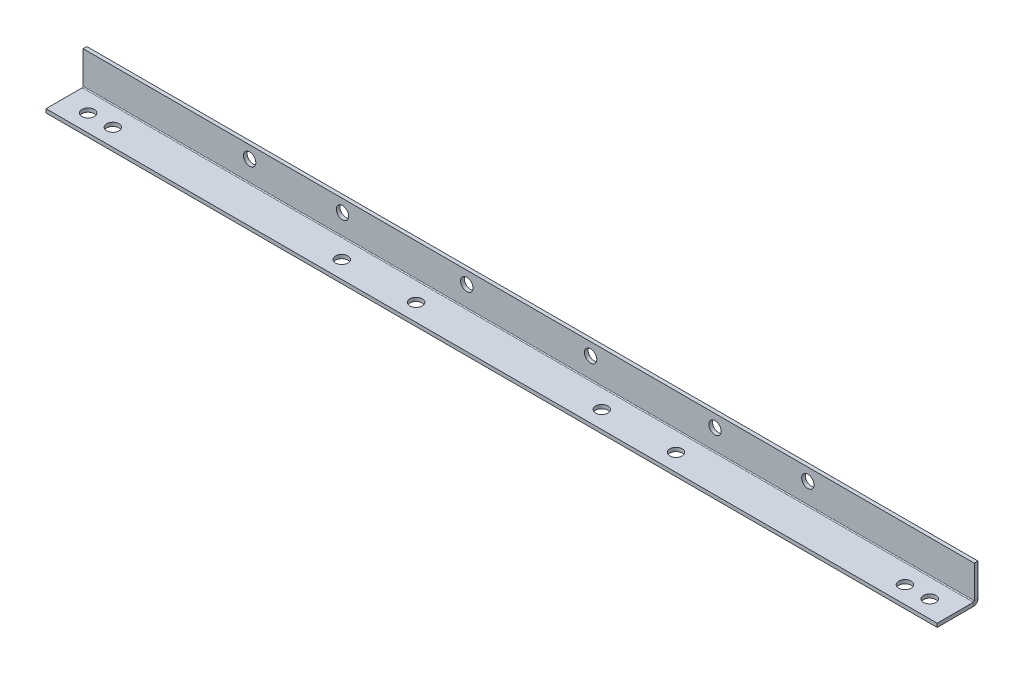
from build123d import *

# Parameters (mm, degrees)
SKETCH3_W                    = 720
SKETCH3_H                    = 30
BASE_FLANGE1_DEPTH           = 3
EDGE_FLANGE1_STRIP_W         = 13.4732
EDGE_FLANGE1_STRIP_H         = 3
EDGE_FLANGE1_STRIP_CUT_DEPTH = 720
EDGE_FLANGE1_DEPTH           = 720
SKETCH10_R                   = 5
CUT_EXTRUDE2_DEPTH           = 10
SKETCH11_R                   = 5
CUT_EXTRUDE3_DEPTH           = 10
SKETCH12_R                   = 5
CUT_EXTRUDE4_DEPTH           = 10


# Sheet-metal steps are written as plain solids
with BuildPart() as part:
    # Sketch3 → Base-Flange1 (new body)
    with BuildSketch(Plane(origin=(0, 0, 0), x_dir=(1, 0, 0), z_dir=(0, 1, 0))):
        Rectangle(SKETCH3_W, SKETCH3_H)
    extrude(amount=-BASE_FLANGE1_DEPTH)

    # Edge-Flange1 strip (across the edge) → Edge-Flange1 strip cut (cut)
    with BuildSketch(Plane(origin=(360, 0, -15), x_dir=(0, 0, 1), z_dir=(-1, 0, 0))):
        with Locations((-6, -1.5)):
            Rectangle(EDGE_FLANGE1_STRIP_W, EDGE_FLANGE1_STRIP_H)
    extrude(amount=EDGE_FLANGE1_STRIP_CUT_DEPTH, mode=Mode.SUBTRACT)

    # Edge-Flange1 section (across the edge) → Edge-Flange1 (add)
    with BuildSketch(Plane(origin=(360, 0, -15), x_dir=(0, 0, 1), z_dir=(-1, 0, 0))):
        with BuildLine():
            Line((-3, 0.7366), (-3, 27))
            Line((-3, 27), (0, 27))
            Line((0, 27), (0, 0.7366))
            ThreePointArc((0, 0.7366), (0.215745145, 0.215745145), (0.7366, 0))
            Line((0.7366, 0), (0.7366, -3))
            ThreePointArc((0.7366, -3), (-1.905575199, -1.905575199), (-3, 0.7366))
        make_face()
    extrude(amount=EDGE_FLANGE1_DEPTH)

    # Sketch10 → Cut-Extrude2 (cut)
    with BuildSketch(Plane(origin=(0, 0, 0), x_dir=(1, 0, 0), z_dir=(0, 1, 0))):
        with Locations(Location((-340, -1, 0), (0, 0, 270))):
            Circle(SKETCH10_R)
        with Locations(Location((-320, -1, 0), (0, 0, 270))):
            Circle(SKETCH10_R)
    cut_extrude2 = extrude(amount=-CUT_EXTRUDE2_DEPTH, mode=Mode.SUBTRACT)

    # Mirror1: Cut-Extrude2 across plane
    add(cut_extrude2.mirror(Plane(origin=(0, 0, 0), x_dir=(0, 0, 1), z_dir=(1, 0, 0))), mode=Mode.SUBTRACT)

    # Sketch11 → Cut-Extrude3 (cut)
    with BuildSketch(Plane.XY.offset(-15)):
        with Locations((225.5, 17)):
            Circle(SKETCH11_R)
        with Locations((-225.5, 17)):
            Circle(SKETCH11_R)
        with Locations((-150.5, 17)):
            Circle(SKETCH11_R)
        with Locations((150.5, 17)):
            Circle(SKETCH11_R)
        with Locations((50, 17)):
            Circle(SKETCH11_R)
        with Locations((-50, 17)):
            Circle(SKETCH11_R)
    extrude(amount=-CUT_EXTRUDE3_DEPTH, mode=Mode.SUBTRACT)

    # Sketch12 → Cut-Extrude4 (cut)
    with BuildSketch(Plane(origin=(0, 0, 0), x_dir=(1, 0, 0), z_dir=(0, 1, 0))):
        with Locations(Location((-75, -1, 0), (0, 0, 270))):
            Circle(SKETCH12_R)
        with Locations(Location((75, -1, 0), (0, 0, 270))):
            Circle(SKETCH12_R)
        with Locations(Location((135, -1, 0), (0, 0, 270))):
            Circle(SKETCH12_R)
        with Locations(Location((-135, -1, 0), (0, 0, 270))):
            Circle(SKETCH12_R)
    extrude(amount=-CUT_EXTRUDE4_DEPTH, mode=Mode.SUBTRACT)


solid = part.part
